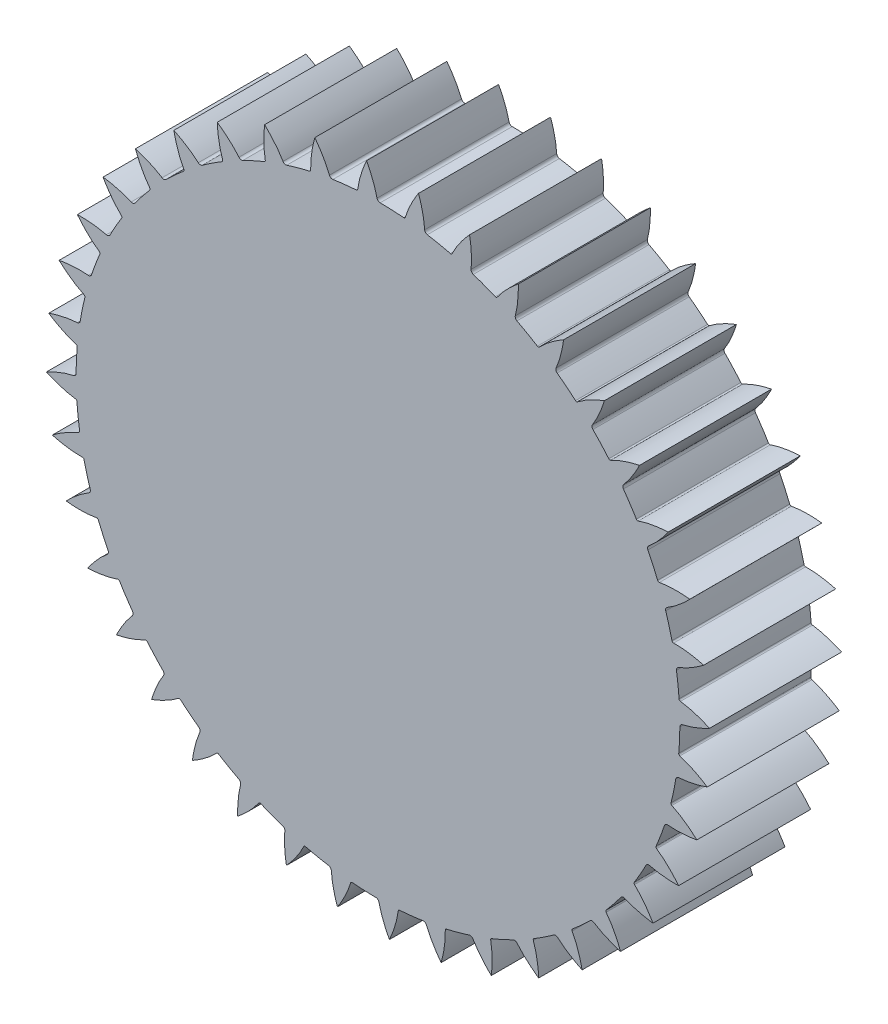
from build123d import *
from OCP.BRepFilletAPI import BRepFilletAPI_MakeFillet

# Parameters (mm, degrees)
SKETCH_1_R                         = 114.3
SKETCH_1_R_2                       = 112.763114494
EXTRUDE_1_DEPTH                    = 25
EXTRUDE_2_DEPTH                    = 25
EXTRUDE_4_DEPTH                    = 25
FILLET_4_R1                        = 0.6
FILLET_4_R2                        = 1.2
PATTERN_CIRCULAR_4_COUNT           = 40
FILLET_4_OF_PATTERN_CIRCULAR_4_R1  = 0.6
FILLET_4_OF_PATTERN_CIRCULAR_4_R2  = 1.2
FILLET_4_OF_PATTERN_CIRCULAR_4_R3  = 0.6
FILLET_4_OF_PATTERN_CIRCULAR_4_R4  = 1.2
FILLET_4_OF_PATTERN_CIRCULAR_4_R5  = 0.6
FILLET_4_OF_PATTERN_CIRCULAR_4_R6  = 1.2
FILLET_4_OF_PATTERN_CIRCULAR_4_R7  = 0.6
FILLET_4_OF_PATTERN_CIRCULAR_4_R8  = 1.2
FILLET_4_OF_PATTERN_CIRCULAR_4_R9  = 0.6
FILLET_4_OF_PATTERN_CIRCULAR_4_R10 = 1.2
FILLET_4_OF_PATTERN_CIRCULAR_4_R11 = 0.6
FILLET_4_OF_PATTERN_CIRCULAR_4_R12 = 1.2
FILLET_4_OF_PATTERN_CIRCULAR_4_R13 = 0.6
FILLET_4_OF_PATTERN_CIRCULAR_4_R14 = 1.2
FILLET_4_OF_PATTERN_CIRCULAR_4_R15 = 0.6
FILLET_4_OF_PATTERN_CIRCULAR_4_R16 = 1.2
FILLET_4_OF_PATTERN_CIRCULAR_4_R17 = 0.6
FILLET_4_OF_PATTERN_CIRCULAR_4_R18 = 1.2
FILLET_4_OF_PATTERN_CIRCULAR_4_R19 = 0.6
FILLET_4_OF_PATTERN_CIRCULAR_4_R20 = 1.2
FILLET_4_OF_PATTERN_CIRCULAR_4_R21 = 0.6
FILLET_4_OF_PATTERN_CIRCULAR_4_R22 = 1.2
FILLET_4_OF_PATTERN_CIRCULAR_4_R23 = 0.6
FILLET_4_OF_PATTERN_CIRCULAR_4_R24 = 1.2
FILLET_4_OF_PATTERN_CIRCULAR_4_R25 = 0.6
FILLET_4_OF_PATTERN_CIRCULAR_4_R26 = 1.2
FILLET_4_OF_PATTERN_CIRCULAR_4_R27 = 0.6
FILLET_4_OF_PATTERN_CIRCULAR_4_R28 = 1.2
FILLET_4_OF_PATTERN_CIRCULAR_4_R29 = 0.6
FILLET_4_OF_PATTERN_CIRCULAR_4_R30 = 1.2
FILLET_4_OF_PATTERN_CIRCULAR_4_R31 = 0.6
FILLET_4_OF_PATTERN_CIRCULAR_4_R32 = 1.2
FILLET_4_OF_PATTERN_CIRCULAR_4_R33 = 0.6
FILLET_4_OF_PATTERN_CIRCULAR_4_R34 = 1.2
FILLET_4_OF_PATTERN_CIRCULAR_4_R35 = 0.6
FILLET_4_OF_PATTERN_CIRCULAR_4_R36 = 1.2
FILLET_4_OF_PATTERN_CIRCULAR_4_R37 = 0.6
FILLET_4_OF_PATTERN_CIRCULAR_4_R38 = 1.2
FILLET_4_OF_PATTERN_CIRCULAR_4_R39 = 0.6
FILLET_4_OF_PATTERN_CIRCULAR_4_R40 = 1.2
FILLET_4_OF_PATTERN_CIRCULAR_4_R41 = 0.6
FILLET_4_OF_PATTERN_CIRCULAR_4_R42 = 1.2
FILLET_4_OF_PATTERN_CIRCULAR_4_R43 = 0.6
FILLET_4_OF_PATTERN_CIRCULAR_4_R44 = 1.2
FILLET_4_OF_PATTERN_CIRCULAR_4_R45 = 0.6
FILLET_4_OF_PATTERN_CIRCULAR_4_R46 = 1.2
FILLET_4_OF_PATTERN_CIRCULAR_4_R47 = 0.6
FILLET_4_OF_PATTERN_CIRCULAR_4_R48 = 1.2
FILLET_4_OF_PATTERN_CIRCULAR_4_R49 = 0.6
FILLET_4_OF_PATTERN_CIRCULAR_4_R50 = 1.2
FILLET_4_OF_PATTERN_CIRCULAR_4_R51 = 0.6
FILLET_4_OF_PATTERN_CIRCULAR_4_R52 = 1.2
FILLET_4_OF_PATTERN_CIRCULAR_4_R53 = 0.6
FILLET_4_OF_PATTERN_CIRCULAR_4_R54 = 1.2
FILLET_4_OF_PATTERN_CIRCULAR_4_R55 = 0.6
FILLET_4_OF_PATTERN_CIRCULAR_4_R56 = 1.2
FILLET_4_OF_PATTERN_CIRCULAR_4_R57 = 0.6
FILLET_4_OF_PATTERN_CIRCULAR_4_R58 = 1.2
FILLET_4_OF_PATTERN_CIRCULAR_4_R59 = 0.6
FILLET_4_OF_PATTERN_CIRCULAR_4_R60 = 1.2
FILLET_4_OF_PATTERN_CIRCULAR_4_R61 = 0.6
FILLET_4_OF_PATTERN_CIRCULAR_4_R62 = 1.2
FILLET_4_OF_PATTERN_CIRCULAR_4_R63 = 0.6
FILLET_4_OF_PATTERN_CIRCULAR_4_R64 = 1.2
FILLET_4_OF_PATTERN_CIRCULAR_4_R65 = 0.6
FILLET_4_OF_PATTERN_CIRCULAR_4_R66 = 1.2
FILLET_4_OF_PATTERN_CIRCULAR_4_R67 = 0.6
FILLET_4_OF_PATTERN_CIRCULAR_4_R68 = 1.2
FILLET_4_OF_PATTERN_CIRCULAR_4_R69 = 0.6
FILLET_4_OF_PATTERN_CIRCULAR_4_R70 = 1.2
FILLET_4_OF_PATTERN_CIRCULAR_4_R71 = 0.6
FILLET_4_OF_PATTERN_CIRCULAR_4_R72 = 1.2
FILLET_4_OF_PATTERN_CIRCULAR_4_R73 = 0.6
FILLET_4_OF_PATTERN_CIRCULAR_4_R74 = 1.2
FILLET_4_OF_PATTERN_CIRCULAR_4_R75 = 0.6
FILLET_4_OF_PATTERN_CIRCULAR_4_R76 = 1.2
FILLET_4_OF_PATTERN_CIRCULAR_4_R77 = 0.6
FILLET_4_OF_PATTERN_CIRCULAR_4_R78 = 1.2


with BuildPart() as part:
    # Эскиз1 → Бобышка-Вытянуть1 (new, symmetric)
    with BuildSketch(Plane.XY):
        Circle(SKETCH_1_R)
        Circle(SKETCH_1_R_2, mode=Mode.SUBTRACT)
    extrude(amount=EXTRUDE_1_DEPTH, both=True)

    # Эскиз2 → Бобышка-Вытянуть2 (add, symmetric)
    with BuildSketch(Plane.XY):
        with BuildLine():
            ThreePointArc((112.763114494, 0), (112.746298262, 1.947361992), (112.69585458, 3.894143168))
            ThreePointArc((112.69585458, 3.894143168), (112.611798493, 5.839762887), (112.494155073, 7.783640851))
            ThreePointArc((112.494155073, 7.783640851), (-112.69585458, -3.894143168), (112.763114494, 0))
        make_face()
    extrude(amount=EXTRUDE_2_DEPTH, both=True)

    # Эскиз3 → Бобышка-Вытянуть4 (add, symmetric)
    with BuildSketch(Plane.XY):
        with BuildLine():
            add(Edge.make_bspline(
                [(112.763114494, 0), (112.850005435, 0.002082868), (113.023608713, 0.009662557), (113.370100639, 0.038399219), (113.870859491, 0.099649526), (114.438218486, 0.18963375), (115.224987553, 0.340792741), (116.266955044, 0.580613344), (117.572097298, 0.94198484), (119.815658636, 1.681433434), (122.058144787, 2.59951989), (123.846513956, 3.449672914), (125.208889843, 4.162084311), (125.537858662, 4.337891544)],
                knots=[0, 0, 0, 0, 0, 0.001401018, 0.002802036, 0.005604071, 0.008132617, 0.010661162, 0.015718253, 0.022839087, 0.029959921, 0.048733673, 0.054747895, 0.054747895, 0.054747895, 0.054747895, 0.054747895], degree=4))
            add(Edge.make_bspline(
                [(112.494155073, 7.783640851), (112.580982536, 7.787560726), (112.75469494, 7.791982339), (113.102344014, 7.787231338), (113.606136364, 7.760692743), (114.178353404, 7.710085942), (114.973679864, 7.61359539), (116.029716055, 7.446270148), (117.356689523, 7.175849961), (119.645941114, 6.593030221), (121.946450827, 5.831924484), (123.789237499, 5.10724405), (125.197539135, 4.490571888), (125.537858662, 4.337891544)],
                knots=[0, 0, 0, 0, 0, 0.001401018, 0.002802036, 0.005604071, 0.008132617, 0.010661162, 0.015718253, 0.022839087, 0.029959921, 0.048733673, 0.054747895, 0.054747895, 0.054747895, 0.054747895, 0.054747895], degree=4))
            ThreePointArc((112.494155073, 7.783640851), (112.69585458, 3.894143168), (112.763114494, 0))
        make_face()
    extrude_4 = extrude(amount=EXTRUDE_4_DEPTH, both=True)

    # Скругление4: one fillet with a radius per group of edges: ONE call of the kernel's fillet builder (fillet() takes one radius for all edges)
    fillet_4_edges_1 = [part.edges().sort_by_distance(p)[0] for p in [
        (114.039012004, 7.719698261, 12.4999997),
    ]]
    fillet_4_edges_2 = [part.edges().sort_by_distance(p)[0] for p in [
        (114.299872944, 0.170426111, 12.4999997),
    ]]
    fillet_4 = BRepFilletAPI_MakeFillet(part.part.solid().wrapped)
    for e in fillet_4_edges_1:
        fillet_4.Add(FILLET_4_R1, e.wrapped)
    for e in fillet_4_edges_2:
        fillet_4.Add(FILLET_4_R2, e.wrapped)
    add(Compound.cast(fillet_4.Shape()), mode=Mode.REPLACE)

    # Круговой массив4: Бобышка-Вытянуть4 ×40 about axis
    pattern_circular_4_axis = Axis((0, 0, 25), (0, 0, -1))
    for i in range(1, PATTERN_CIRCULAR_4_COUNT):
        add(extrude_4.rotate(pattern_circular_4_axis, i * 360 / PATTERN_CIRCULAR_4_COUNT))

    # Скругление4 of Круговой массив4: one fillet with a radius per group of edges: ONE call of the kernel's fillet builder (fillet() takes one radius for all edges)
    fillet_4_of_pattern_circular_4_edges_1 = [part.edges().sort_by_distance(p)[0] for p in [
        (113.842629397, -10.214975871, 12.4999997),
    ]]
    fillet_4_of_pattern_circular_4_edges_2 = [part.edges().sort_by_distance(p)[0] for p in [
        (112.919312356, -17.712111595, 12.4999997),
    ]]
    fillet_4_of_pattern_circular_4_edges_3 = [part.edges().sort_by_distance(p)[0] for p in [
        (110.843063432, -27.898123396, 12.4999997),
    ]]
    fillet_4_of_pattern_circular_4_edges_4 = [part.edges().sort_by_distance(p)[0] for p in [
        (108.75830354, -35.158518331, 12.4999997),
    ]]
    fillet_4_of_pattern_circular_4_edges_5 = [part.edges().sort_by_distance(p)[0] for p in [
        (105.114173379, -44.894326534, 12.4999997),
    ]]
    fillet_4_of_pattern_circular_4_edges_6 = [part.edges().sort_by_distance(p)[0] for p in [
        (101.919304342, -51.739205661, 12.4999997),
    ]]
    fillet_4_of_pattern_circular_4_edges_7 = [part.edges().sort_by_distance(p)[0] for p in [
        (96.797023523, -60.785082357, 12.4999997),
    ]]
    fillet_4_of_pattern_circular_4_edges_8 = [part.edges().sort_by_distance(p)[0] for p in [
        (92.570713621, -67.045902035, 12.4999997),
    ]]
    fillet_4_of_pattern_circular_4_edges_9 = [part.edges().sort_by_distance(p)[0] for p in [
        (86.096409697, -75.179107719, 12.4999997),
    ]]
    fillet_4_of_pattern_circular_4_edges_10 = [part.edges().sort_by_distance(p)[0] for p in [
        (80.942724706, -80.701705788, 12.4999997),
    ]]
    fillet_4_of_pattern_circular_4_edges_11 = [part.edges().sort_by_distance(p)[0] for p in [
        (73.275816526, -87.721973943, 12.4999997),
    ]]
    fillet_4_of_pattern_circular_4_edges_12 = [part.edges().sort_by_distance(p)[0] for p in [
        (67.321657276, -92.370365711, 12.4999997),
    ]]
    fillet_4_of_pattern_circular_4_edges_13 = [part.edges().sort_by_distance(p)[0] for p in [
        (58.650929565, -98.104834036, 12.4999997),
    ]]
    fillet_4_of_pattern_circular_4_edges_14 = [part.edges().sort_by_distance(p)[0] for p in [
        (52.042907215, -101.764560671, 12.4999997),
    ]]
    fillet_4_of_pattern_circular_4_edges_15 = [part.edges().sort_by_distance(p)[0] for p in [
        (42.581862066, -106.072027524, 12.4999997),
    ]]
    fillet_4_of_pattern_circular_4_edges_16 = [part.edges().sort_by_distance(p)[0] for p in [
        (35.482688058, -108.65297441, 12.4999997),
    ]]
    fillet_4_of_pattern_circular_4_edges_17 = [part.edges().sort_by_distance(p)[0] for p in [
        (25.464287802, -111.427375661, 12.4999997),
    ]]
    fillet_4_of_pattern_circular_4_edges_18 = [part.edges().sort_by_distance(p)[0] for p in [
        (18.048767361, -112.86599132, 12.4999997),
    ]]
    fillet_4_of_pattern_circular_4_edges_19 = [part.edges().sort_by_distance(p)[0] for p in [
        (7.719698261, -114.039012004, 12.4999997),
    ]]
    fillet_4_of_pattern_circular_4_edges_20 = [part.edges().sort_by_distance(p)[0] for p in [
        (0.170426111, -114.299872944, 12.4999997),
    ]]
    fillet_4_of_pattern_circular_4_edges_21 = [part.edges().sort_by_distance(p)[0] for p in [
        (-10.214975871, -113.842629397, 12.4999997),
    ]]
    fillet_4_of_pattern_circular_4_edges_22 = [part.edges().sort_by_distance(p)[0] for p in [
        (-17.712111595, -112.919312356, 12.4999997),
    ]]
    fillet_4_of_pattern_circular_4_edges_23 = [part.edges().sort_by_distance(p)[0] for p in [
        (-27.898123396, -110.843063432, 12.4999997),
    ]]
    fillet_4_of_pattern_circular_4_edges_24 = [part.edges().sort_by_distance(p)[0] for p in [
        (-35.158518331, -108.75830354, 12.4999997),
    ]]
    fillet_4_of_pattern_circular_4_edges_25 = [part.edges().sort_by_distance(p)[0] for p in [
        (-44.894326534, -105.114173379, 12.4999997),
    ]]
    fillet_4_of_pattern_circular_4_edges_26 = [part.edges().sort_by_distance(p)[0] for p in [
        (-51.739205661, -101.919304342, 12.4999997),
    ]]
    fillet_4_of_pattern_circular_4_edges_27 = [part.edges().sort_by_distance(p)[0] for p in [
        (-60.785082357, -96.797023523, 12.4999997),
    ]]
    fillet_4_of_pattern_circular_4_edges_28 = [part.edges().sort_by_distance(p)[0] for p in [
        (-67.045902035, -92.570713621, 12.4999997),
    ]]
    fillet_4_of_pattern_circular_4_edges_29 = [part.edges().sort_by_distance(p)[0] for p in [
        (-75.179107719, -86.096409697, 12.4999997),
    ]]
    fillet_4_of_pattern_circular_4_edges_30 = [part.edges().sort_by_distance(p)[0] for p in [
        (-80.701705788, -80.942724706, 12.4999997),
    ]]
    fillet_4_of_pattern_circular_4_edges_31 = [part.edges().sort_by_distance(p)[0] for p in [
        (-87.721973943, -73.275816526, 12.4999997),
    ]]
    fillet_4_of_pattern_circular_4_edges_32 = [part.edges().sort_by_distance(p)[0] for p in [
        (-92.370365711, -67.321657276, 12.4999997),
    ]]
    fillet_4_of_pattern_circular_4_edges_33 = [part.edges().sort_by_distance(p)[0] for p in [
        (-98.104834036, -58.650929565, 12.4999997),
    ]]
    fillet_4_of_pattern_circular_4_edges_34 = [part.edges().sort_by_distance(p)[0] for p in [
        (-101.764560671, -52.042907215, 12.4999997),
    ]]
    fillet_4_of_pattern_circular_4_edges_35 = [part.edges().sort_by_distance(p)[0] for p in [
        (-106.072027524, -42.581862066, 12.4999997),
    ]]
    fillet_4_of_pattern_circular_4_edges_36 = [part.edges().sort_by_distance(p)[0] for p in [
        (-108.65297441, -35.482688058, 12.4999997),
    ]]
    fillet_4_of_pattern_circular_4_edges_37 = [part.edges().sort_by_distance(p)[0] for p in [
        (-111.427375661, -25.464287802, 12.4999997),
    ]]
    fillet_4_of_pattern_circular_4_edges_38 = [part.edges().sort_by_distance(p)[0] for p in [
        (-112.86599132, -18.048767361, 12.4999997),
    ]]
    fillet_4_of_pattern_circular_4_edges_39 = [part.edges().sort_by_distance(p)[0] for p in [
        (-114.039012004, -7.719698261, 12.4999997),
    ]]
    fillet_4_of_pattern_circular_4_edges_40 = [part.edges().sort_by_distance(p)[0] for p in [
        (-114.299872944, -0.170426111, 12.4999997),
    ]]
    fillet_4_of_pattern_circular_4_edges_41 = [part.edges().sort_by_distance(p)[0] for p in [
        (-113.842629397, 10.214975871, 12.4999997),
    ]]
    fillet_4_of_pattern_circular_4_edges_42 = [part.edges().sort_by_distance(p)[0] for p in [
        (-112.919312356, 17.712111595, 12.4999997),
    ]]
    fillet_4_of_pattern_circular_4_edges_43 = [part.edges().sort_by_distance(p)[0] for p in [
        (-110.843063432, 27.898123396, 12.4999997),
    ]]
    fillet_4_of_pattern_circular_4_edges_44 = [part.edges().sort_by_distance(p)[0] for p in [
        (-108.75830354, 35.158518331, 12.4999997),
    ]]
    fillet_4_of_pattern_circular_4_edges_45 = [part.edges().sort_by_distance(p)[0] for p in [
        (-105.114173379, 44.894326534, 12.4999997),
    ]]
    fillet_4_of_pattern_circular_4_edges_46 = [part.edges().sort_by_distance(p)[0] for p in [
        (-101.919304342, 51.739205661, 12.4999997),
    ]]
    fillet_4_of_pattern_circular_4_edges_47 = [part.edges().sort_by_distance(p)[0] for p in [
        (-96.797023523, 60.785082357, 12.4999997),
    ]]
    fillet_4_of_pattern_circular_4_edges_48 = [part.edges().sort_by_distance(p)[0] for p in [
        (-92.570713621, 67.045902035, 12.4999997),
    ]]
    fillet_4_of_pattern_circular_4_edges_49 = [part.edges().sort_by_distance(p)[0] for p in [
        (-86.096409697, 75.179107719, 12.4999997),
    ]]
    fillet_4_of_pattern_circular_4_edges_50 = [part.edges().sort_by_distance(p)[0] for p in [
        (-80.942724706, 80.701705788, 12.4999997),
    ]]
    fillet_4_of_pattern_circular_4_edges_51 = [part.edges().sort_by_distance(p)[0] for p in [
        (-73.275816526, 87.721973943, 12.4999997),
    ]]
    fillet_4_of_pattern_circular_4_edges_52 = [part.edges().sort_by_distance(p)[0] for p in [
        (-67.321657276, 92.370365711, 12.4999997),
    ]]
    fillet_4_of_pattern_circular_4_edges_53 = [part.edges().sort_by_distance(p)[0] for p in [
        (-58.650929565, 98.104834036, 12.4999997),
    ]]
    fillet_4_of_pattern_circular_4_edges_54 = [part.edges().sort_by_distance(p)[0] for p in [
        (-52.042907215, 101.764560671, 12.4999997),
    ]]
    fillet_4_of_pattern_circular_4_edges_55 = [part.edges().sort_by_distance(p)[0] for p in [
        (-42.581862066, 106.072027524, 12.4999997),
    ]]
    fillet_4_of_pattern_circular_4_edges_56 = [part.edges().sort_by_distance(p)[0] for p in [
        (-35.482688058, 108.65297441, 12.4999997),
    ]]
    fillet_4_of_pattern_circular_4_edges_57 = [part.edges().sort_by_distance(p)[0] for p in [
        (-25.464287802, 111.427375661, 12.4999997),
    ]]
    fillet_4_of_pattern_circular_4_edges_58 = [part.edges().sort_by_distance(p)[0] for p in [
        (-18.048767361, 112.86599132, 12.4999997),
    ]]
    fillet_4_of_pattern_circular_4_edges_59 = [part.edges().sort_by_distance(p)[0] for p in [
        (-7.719698261, 114.039012004, 12.4999997),
    ]]
    fillet_4_of_pattern_circular_4_edges_60 = [part.edges().sort_by_distance(p)[0] for p in [
        (-0.170426111, 114.299872944, 12.4999997),
    ]]
    fillet_4_of_pattern_circular_4_edges_61 = [part.edges().sort_by_distance(p)[0] for p in [
        (10.214975871, 113.842629397, 12.4999997),
    ]]
    fillet_4_of_pattern_circular_4_edges_62 = [part.edges().sort_by_distance(p)[0] for p in [
        (17.712111595, 112.919312356, 12.4999997),
    ]]
    fillet_4_of_pattern_circular_4_edges_63 = [part.edges().sort_by_distance(p)[0] for p in [
        (27.898123396, 110.843063432, 12.4999997),
    ]]
    fillet_4_of_pattern_circular_4_edges_64 = [part.edges().sort_by_distance(p)[0] for p in [
        (35.158518331, 108.75830354, 12.4999997),
    ]]
    fillet_4_of_pattern_circular_4_edges_65 = [part.edges().sort_by_distance(p)[0] for p in [
        (44.894326534, 105.114173379, 12.4999997),
    ]]
    fillet_4_of_pattern_circular_4_edges_66 = [part.edges().sort_by_distance(p)[0] for p in [
        (51.739205661, 101.919304342, 12.4999997),
    ]]
    fillet_4_of_pattern_circular_4_edges_67 = [part.edges().sort_by_distance(p)[0] for p in [
        (60.785082357, 96.797023523, 12.4999997),
    ]]
    fillet_4_of_pattern_circular_4_edges_68 = [part.edges().sort_by_distance(p)[0] for p in [
        (67.045902035, 92.570713621, 12.4999997),
    ]]
    fillet_4_of_pattern_circular_4_edges_69 = [part.edges().sort_by_distance(p)[0] for p in [
        (75.179107719, 86.096409697, 12.4999997),
    ]]
    fillet_4_of_pattern_circular_4_edges_70 = [part.edges().sort_by_distance(p)[0] for p in [
        (80.701705788, 80.942724706, 12.4999997),
    ]]
    fillet_4_of_pattern_circular_4_edges_71 = [part.edges().sort_by_distance(p)[0] for p in [
        (87.721973943, 73.275816526, 12.4999997),
    ]]
    fillet_4_of_pattern_circular_4_edges_72 = [part.edges().sort_by_distance(p)[0] for p in [
        (92.370365711, 67.321657276, 12.4999997),
    ]]
    fillet_4_of_pattern_circular_4_edges_73 = [part.edges().sort_by_distance(p)[0] for p in [
        (98.104834036, 58.650929565, 12.4999997),
    ]]
    fillet_4_of_pattern_circular_4_edges_74 = [part.edges().sort_by_distance(p)[0] for p in [
        (101.764560671, 52.042907215, 12.4999997),
    ]]
    fillet_4_of_pattern_circular_4_edges_75 = [part.edges().sort_by_distance(p)[0] for p in [
        (106.072027524, 42.581862066, 12.4999997),
    ]]
    fillet_4_of_pattern_circular_4_edges_76 = [part.edges().sort_by_distance(p)[0] for p in [
        (108.65297441, 35.482688058, 12.4999997),
    ]]
    fillet_4_of_pattern_circular_4_edges_77 = [part.edges().sort_by_distance(p)[0] for p in [
        (111.427375661, 25.464287802, 12.4999997),
    ]]
    fillet_4_of_pattern_circular_4_edges_78 = [part.edges().sort_by_distance(p)[0] for p in [
        (112.86599132, 18.048767361, 12.4999997),
    ]]
    fillet_4_of_pattern_circular_4 = BRepFilletAPI_MakeFillet(part.part.solid().wrapped)
    for e in fillet_4_of_pattern_circular_4_edges_1:
        fillet_4_of_pattern_circular_4.Add(FILLET_4_OF_PATTERN_CIRCULAR_4_R1, e.wrapped)
    for e in fillet_4_of_pattern_circular_4_edges_2:
        fillet_4_of_pattern_circular_4.Add(FILLET_4_OF_PATTERN_CIRCULAR_4_R2, e.wrapped)
    for e in fillet_4_of_pattern_circular_4_edges_3:
        fillet_4_of_pattern_circular_4.Add(FILLET_4_OF_PATTERN_CIRCULAR_4_R3, e.wrapped)
    for e in fillet_4_of_pattern_circular_4_edges_4:
        fillet_4_of_pattern_circular_4.Add(FILLET_4_OF_PATTERN_CIRCULAR_4_R4, e.wrapped)
    for e in fillet_4_of_pattern_circular_4_edges_5:
        fillet_4_of_pattern_circular_4.Add(FILLET_4_OF_PATTERN_CIRCULAR_4_R5, e.wrapped)
    for e in fillet_4_of_pattern_circular_4_edges_6:
        fillet_4_of_pattern_circular_4.Add(FILLET_4_OF_PATTERN_CIRCULAR_4_R6, e.wrapped)
    for e in fillet_4_of_pattern_circular_4_edges_7:
        fillet_4_of_pattern_circular_4.Add(FILLET_4_OF_PATTERN_CIRCULAR_4_R7, e.wrapped)
    for e in fillet_4_of_pattern_circular_4_edges_8:
        fillet_4_of_pattern_circular_4.Add(FILLET_4_OF_PATTERN_CIRCULAR_4_R8, e.wrapped)
    for e in fillet_4_of_pattern_circular_4_edges_9:
        fillet_4_of_pattern_circular_4.Add(FILLET_4_OF_PATTERN_CIRCULAR_4_R9, e.wrapped)
    for e in fillet_4_of_pattern_circular_4_edges_10:
        fillet_4_of_pattern_circular_4.Add(FILLET_4_OF_PATTERN_CIRCULAR_4_R10, e.wrapped)
    for e in fillet_4_of_pattern_circular_4_edges_11:
        fillet_4_of_pattern_circular_4.Add(FILLET_4_OF_PATTERN_CIRCULAR_4_R11, e.wrapped)
    for e in fillet_4_of_pattern_circular_4_edges_12:
        fillet_4_of_pattern_circular_4.Add(FILLET_4_OF_PATTERN_CIRCULAR_4_R12, e.wrapped)
    for e in fillet_4_of_pattern_circular_4_edges_13:
        fillet_4_of_pattern_circular_4.Add(FILLET_4_OF_PATTERN_CIRCULAR_4_R13, e.wrapped)
    for e in fillet_4_of_pattern_circular_4_edges_14:
        fillet_4_of_pattern_circular_4.Add(FILLET_4_OF_PATTERN_CIRCULAR_4_R14, e.wrapped)
    for e in fillet_4_of_pattern_circular_4_edges_15:
        fillet_4_of_pattern_circular_4.Add(FILLET_4_OF_PATTERN_CIRCULAR_4_R15, e.wrapped)
    for e in fillet_4_of_pattern_circular_4_edges_16:
        fillet_4_of_pattern_circular_4.Add(FILLET_4_OF_PATTERN_CIRCULAR_4_R16, e.wrapped)
    for e in fillet_4_of_pattern_circular_4_edges_17:
        fillet_4_of_pattern_circular_4.Add(FILLET_4_OF_PATTERN_CIRCULAR_4_R17, e.wrapped)
    for e in fillet_4_of_pattern_circular_4_edges_18:
        fillet_4_of_pattern_circular_4.Add(FILLET_4_OF_PATTERN_CIRCULAR_4_R18, e.wrapped)
    for e in fillet_4_of_pattern_circular_4_edges_19:
        fillet_4_of_pattern_circular_4.Add(FILLET_4_OF_PATTERN_CIRCULAR_4_R19, e.wrapped)
    for e in fillet_4_of_pattern_circular_4_edges_20:
        fillet_4_of_pattern_circular_4.Add(FILLET_4_OF_PATTERN_CIRCULAR_4_R20, e.wrapped)
    for e in fillet_4_of_pattern_circular_4_edges_21:
        fillet_4_of_pattern_circular_4.Add(FILLET_4_OF_PATTERN_CIRCULAR_4_R21, e.wrapped)
    for e in fillet_4_of_pattern_circular_4_edges_22:
        fillet_4_of_pattern_circular_4.Add(FILLET_4_OF_PATTERN_CIRCULAR_4_R22, e.wrapped)
    for e in fillet_4_of_pattern_circular_4_edges_23:
        fillet_4_of_pattern_circular_4.Add(FILLET_4_OF_PATTERN_CIRCULAR_4_R23, e.wrapped)
    for e in fillet_4_of_pattern_circular_4_edges_24:
        fillet_4_of_pattern_circular_4.Add(FILLET_4_OF_PATTERN_CIRCULAR_4_R24, e.wrapped)
    for e in fillet_4_of_pattern_circular_4_edges_25:
        fillet_4_of_pattern_circular_4.Add(FILLET_4_OF_PATTERN_CIRCULAR_4_R25, e.wrapped)
    for e in fillet_4_of_pattern_circular_4_edges_26:
        fillet_4_of_pattern_circular_4.Add(FILLET_4_OF_PATTERN_CIRCULAR_4_R26, e.wrapped)
    for e in fillet_4_of_pattern_circular_4_edges_27:
        fillet_4_of_pattern_circular_4.Add(FILLET_4_OF_PATTERN_CIRCULAR_4_R27, e.wrapped)
    for e in fillet_4_of_pattern_circular_4_edges_28:
        fillet_4_of_pattern_circular_4.Add(FILLET_4_OF_PATTERN_CIRCULAR_4_R28, e.wrapped)
    for e in fillet_4_of_pattern_circular_4_edges_29:
        fillet_4_of_pattern_circular_4.Add(FILLET_4_OF_PATTERN_CIRCULAR_4_R29, e.wrapped)
    for e in fillet_4_of_pattern_circular_4_edges_30:
        fillet_4_of_pattern_circular_4.Add(FILLET_4_OF_PATTERN_CIRCULAR_4_R30, e.wrapped)
    for e in fillet_4_of_pattern_circular_4_edges_31:
        fillet_4_of_pattern_circular_4.Add(FILLET_4_OF_PATTERN_CIRCULAR_4_R31, e.wrapped)
    for e in fillet_4_of_pattern_circular_4_edges_32:
        fillet_4_of_pattern_circular_4.Add(FILLET_4_OF_PATTERN_CIRCULAR_4_R32, e.wrapped)
    for e in fillet_4_of_pattern_circular_4_edges_33:
        fillet_4_of_pattern_circular_4.Add(FILLET_4_OF_PATTERN_CIRCULAR_4_R33, e.wrapped)
    for e in fillet_4_of_pattern_circular_4_edges_34:
        fillet_4_of_pattern_circular_4.Add(FILLET_4_OF_PATTERN_CIRCULAR_4_R34, e.wrapped)
    for e in fillet_4_of_pattern_circular_4_edges_35:
        fillet_4_of_pattern_circular_4.Add(FILLET_4_OF_PATTERN_CIRCULAR_4_R35, e.wrapped)
    for e in fillet_4_of_pattern_circular_4_edges_36:
        fillet_4_of_pattern_circular_4.Add(FILLET_4_OF_PATTERN_CIRCULAR_4_R36, e.wrapped)
    for e in fillet_4_of_pattern_circular_4_edges_37:
        fillet_4_of_pattern_circular_4.Add(FILLET_4_OF_PATTERN_CIRCULAR_4_R37, e.wrapped)
    for e in fillet_4_of_pattern_circular_4_edges_38:
        fillet_4_of_pattern_circular_4.Add(FILLET_4_OF_PATTERN_CIRCULAR_4_R38, e.wrapped)
    for e in fillet_4_of_pattern_circular_4_edges_39:
        fillet_4_of_pattern_circular_4.Add(FILLET_4_OF_PATTERN_CIRCULAR_4_R39, e.wrapped)
    for e in fillet_4_of_pattern_circular_4_edges_40:
        fillet_4_of_pattern_circular_4.Add(FILLET_4_OF_PATTERN_CIRCULAR_4_R40, e.wrapped)
    for e in fillet_4_of_pattern_circular_4_edges_41:
        fillet_4_of_pattern_circular_4.Add(FILLET_4_OF_PATTERN_CIRCULAR_4_R41, e.wrapped)
    for e in fillet_4_of_pattern_circular_4_edges_42:
        fillet_4_of_pattern_circular_4.Add(FILLET_4_OF_PATTERN_CIRCULAR_4_R42, e.wrapped)
    for e in fillet_4_of_pattern_circular_4_edges_43:
        fillet_4_of_pattern_circular_4.Add(FILLET_4_OF_PATTERN_CIRCULAR_4_R43, e.wrapped)
    for e in fillet_4_of_pattern_circular_4_edges_44:
        fillet_4_of_pattern_circular_4.Add(FILLET_4_OF_PATTERN_CIRCULAR_4_R44, e.wrapped)
    for e in fillet_4_of_pattern_circular_4_edges_45:
        fillet_4_of_pattern_circular_4.Add(FILLET_4_OF_PATTERN_CIRCULAR_4_R45, e.wrapped)
    for e in fillet_4_of_pattern_circular_4_edges_46:
        fillet_4_of_pattern_circular_4.Add(FILLET_4_OF_PATTERN_CIRCULAR_4_R46, e.wrapped)
    for e in fillet_4_of_pattern_circular_4_edges_47:
        fillet_4_of_pattern_circular_4.Add(FILLET_4_OF_PATTERN_CIRCULAR_4_R47, e.wrapped)
    for e in fillet_4_of_pattern_circular_4_edges_48:
        fillet_4_of_pattern_circular_4.Add(FILLET_4_OF_PATTERN_CIRCULAR_4_R48, e.wrapped)
    for e in fillet_4_of_pattern_circular_4_edges_49:
        fillet_4_of_pattern_circular_4.Add(FILLET_4_OF_PATTERN_CIRCULAR_4_R49, e.wrapped)
    for e in fillet_4_of_pattern_circular_4_edges_50:
        fillet_4_of_pattern_circular_4.Add(FILLET_4_OF_PATTERN_CIRCULAR_4_R50, e.wrapped)
    for e in fillet_4_of_pattern_circular_4_edges_51:
        fillet_4_of_pattern_circular_4.Add(FILLET_4_OF_PATTERN_CIRCULAR_4_R51, e.wrapped)
    for e in fillet_4_of_pattern_circular_4_edges_52:
        fillet_4_of_pattern_circular_4.Add(FILLET_4_OF_PATTERN_CIRCULAR_4_R52, e.wrapped)
    for e in fillet_4_of_pattern_circular_4_edges_53:
        fillet_4_of_pattern_circular_4.Add(FILLET_4_OF_PATTERN_CIRCULAR_4_R53, e.wrapped)
    for e in fillet_4_of_pattern_circular_4_edges_54:
        fillet_4_of_pattern_circular_4.Add(FILLET_4_OF_PATTERN_CIRCULAR_4_R54, e.wrapped)
    for e in fillet_4_of_pattern_circular_4_edges_55:
        fillet_4_of_pattern_circular_4.Add(FILLET_4_OF_PATTERN_CIRCULAR_4_R55, e.wrapped)
    for e in fillet_4_of_pattern_circular_4_edges_56:
        fillet_4_of_pattern_circular_4.Add(FILLET_4_OF_PATTERN_CIRCULAR_4_R56, e.wrapped)
    for e in fillet_4_of_pattern_circular_4_edges_57:
        fillet_4_of_pattern_circular_4.Add(FILLET_4_OF_PATTERN_CIRCULAR_4_R57, e.wrapped)
    for e in fillet_4_of_pattern_circular_4_edges_58:
        fillet_4_of_pattern_circular_4.Add(FILLET_4_OF_PATTERN_CIRCULAR_4_R58, e.wrapped)
    for e in fillet_4_of_pattern_circular_4_edges_59:
        fillet_4_of_pattern_circular_4.Add(FILLET_4_OF_PATTERN_CIRCULAR_4_R59, e.wrapped)
    for e in fillet_4_of_pattern_circular_4_edges_60:
        fillet_4_of_pattern_circular_4.Add(FILLET_4_OF_PATTERN_CIRCULAR_4_R60, e.wrapped)
    for e in fillet_4_of_pattern_circular_4_edges_61:
        fillet_4_of_pattern_circular_4.Add(FILLET_4_OF_PATTERN_CIRCULAR_4_R61, e.wrapped)
    for e in fillet_4_of_pattern_circular_4_edges_62:
        fillet_4_of_pattern_circular_4.Add(FILLET_4_OF_PATTERN_CIRCULAR_4_R62, e.wrapped)
    for e in fillet_4_of_pattern_circular_4_edges_63:
        fillet_4_of_pattern_circular_4.Add(FILLET_4_OF_PATTERN_CIRCULAR_4_R63, e.wrapped)
    for e in fillet_4_of_pattern_circular_4_edges_64:
        fillet_4_of_pattern_circular_4.Add(FILLET_4_OF_PATTERN_CIRCULAR_4_R64, e.wrapped)
    for e in fillet_4_of_pattern_circular_4_edges_65:
        fillet_4_of_pattern_circular_4.Add(FILLET_4_OF_PATTERN_CIRCULAR_4_R65, e.wrapped)
    for e in fillet_4_of_pattern_circular_4_edges_66:
        fillet_4_of_pattern_circular_4.Add(FILLET_4_OF_PATTERN_CIRCULAR_4_R66, e.wrapped)
    for e in fillet_4_of_pattern_circular_4_edges_67:
        fillet_4_of_pattern_circular_4.Add(FILLET_4_OF_PATTERN_CIRCULAR_4_R67, e.wrapped)
    for e in fillet_4_of_pattern_circular_4_edges_68:
        fillet_4_of_pattern_circular_4.Add(FILLET_4_OF_PATTERN_CIRCULAR_4_R68, e.wrapped)
    for e in fillet_4_of_pattern_circular_4_edges_69:
        fillet_4_of_pattern_circular_4.Add(FILLET_4_OF_PATTERN_CIRCULAR_4_R69, e.wrapped)
    for e in fillet_4_of_pattern_circular_4_edges_70:
        fillet_4_of_pattern_circular_4.Add(FILLET_4_OF_PATTERN_CIRCULAR_4_R70, e.wrapped)
    for e in fillet_4_of_pattern_circular_4_edges_71:
        fillet_4_of_pattern_circular_4.Add(FILLET_4_OF_PATTERN_CIRCULAR_4_R71, e.wrapped)
    for e in fillet_4_of_pattern_circular_4_edges_72:
        fillet_4_of_pattern_circular_4.Add(FILLET_4_OF_PATTERN_CIRCULAR_4_R72, e.wrapped)
    for e in fillet_4_of_pattern_circular_4_edges_73:
        fillet_4_of_pattern_circular_4.Add(FILLET_4_OF_PATTERN_CIRCULAR_4_R73, e.wrapped)
    for e in fillet_4_of_pattern_circular_4_edges_74:
        fillet_4_of_pattern_circular_4.Add(FILLET_4_OF_PATTERN_CIRCULAR_4_R74, e.wrapped)
    for e in fillet_4_of_pattern_circular_4_edges_75:
        fillet_4_of_pattern_circular_4.Add(FILLET_4_OF_PATTERN_CIRCULAR_4_R75, e.wrapped)
    for e in fillet_4_of_pattern_circular_4_edges_76:
        fillet_4_of_pattern_circular_4.Add(FILLET_4_OF_PATTERN_CIRCULAR_4_R76, e.wrapped)
    for e in fillet_4_of_pattern_circular_4_edges_77:
        fillet_4_of_pattern_circular_4.Add(FILLET_4_OF_PATTERN_CIRCULAR_4_R77, e.wrapped)
    for e in fillet_4_of_pattern_circular_4_edges_78:
        fillet_4_of_pattern_circular_4.Add(FILLET_4_OF_PATTERN_CIRCULAR_4_R78, e.wrapped)
    add(Compound.cast(fillet_4_of_pattern_circular_4.Shape()), mode=Mode.REPLACE)


solid = part.part
